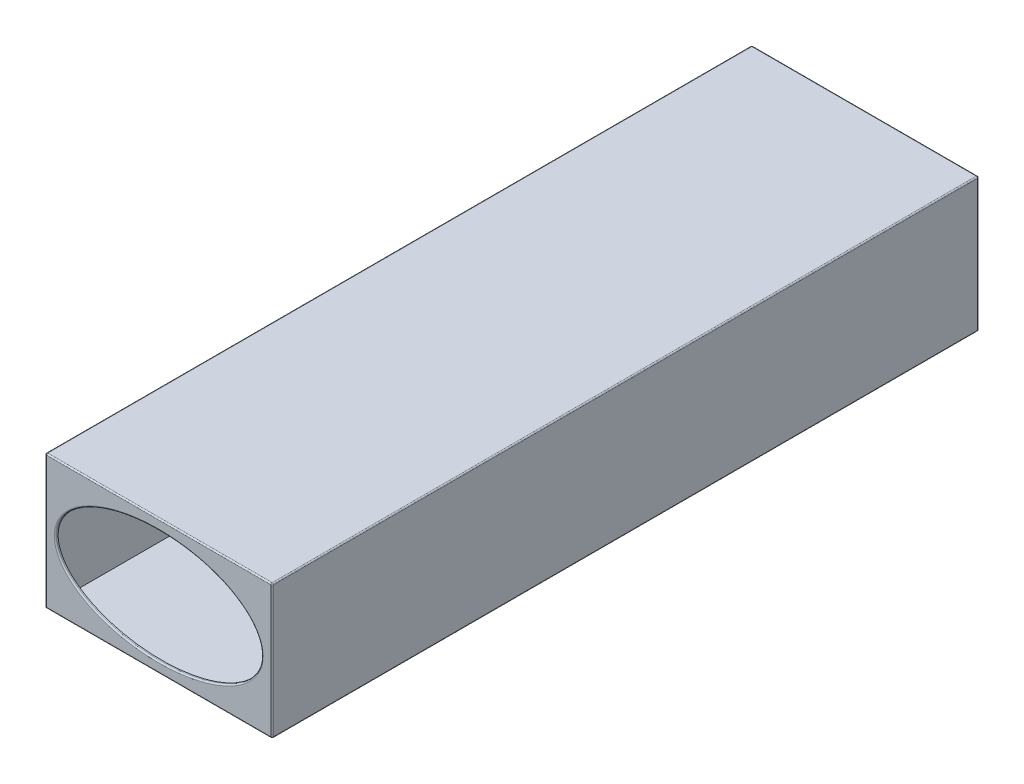
from build123d import *

# Parameters (mm, degrees)
SKETCH1_W           = 44
SKETCH1_H           = 137
BOSS_EXTRUDE1_DEPTH = 26
SKETCH2_RX          = 20
SKETCH2_RY          = 11
CUT_EXTRUDE1_DEPTH  = 0.5
SHELL1_START        = -68
SHELL1_OUTLINE_W    = 43
SHELL1_OUTLINE_H    = 25
SHELL1_DEPTH        = 136
FILLET1_R           = 0.25


# Read off the part's stored shape, not the designer's step: Shell1
with BuildPart() as part:
    # Sketch1 → Boss-Extrude1 (new body)
    with BuildSketch(Plane(origin=(0, 0, 0), x_dir=(1, 0, 0), z_dir=(0, 1, 0))):
        Rectangle(SKETCH1_W, SKETCH1_H)
    extrude(amount=BOSS_EXTRUDE1_DEPTH)

    # Sketch2 → Cut-Extrude1 (cut)
    with BuildSketch(Plane.XY.offset(68.5)):
        with Locations((0, 13)):
            Ellipse(SKETCH2_RX, SKETCH2_RY)
    extrude(amount=-CUT_EXTRUDE1_DEPTH, mode=Mode.SUBTRACT)

    # Shell1 outline → Shell1 (cut)
    with BuildSketch(Plane.XY.offset(SHELL1_START)):
        with Locations((0, 13)):
            Rectangle(SHELL1_OUTLINE_W, SHELL1_OUTLINE_H)
    extrude(amount=SHELL1_DEPTH, mode=Mode.SUBTRACT)

    # Fillet1
    fillet1_edges = [part.edges().sort_by_distance(p)[0] for p in [
        (-22, 26, 0),
        (-19.999850375, 12.957450604, 68.5),
        (0, 26, 68.5),
        (22, 26, 0),
        (0, 0, 68.5),
        (-22, 0, 0),
        (0, 0, -68.5),
        (22, 0, 0),
        (22, 13, 68.5),
        (-22, 13, 68.5),
        (-22, 13, -68.5),
        (22, 13, -68.5),
        (0, 26, -68.5),
    ]]
    fillet(fillet1_edges, radius=FILLET1_R)


solid = part.part
